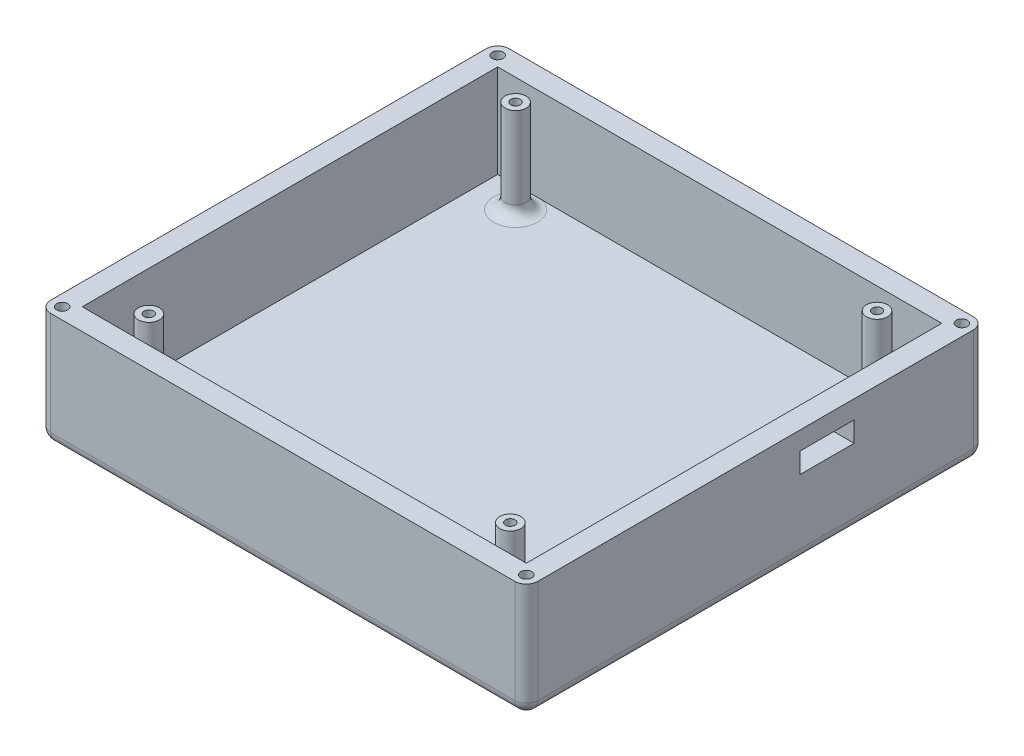
from build123d import *

# Parameters (mm, degrees)
SKETCH1_W            = 107.95
SKETCH1_H            = 25.4
BOSS_EXTRUDE1_DEPTH  = 50.8
SKETCH2_W            = 98.425
SKETCH2_H            = 92.075
CUT_EXTRUDE1_DEPTH   = 20.6375
FILLET1_R            = 2.54
FILLET2_R            = 2.54
SKETCH8_R            = 1.2192
CUT_EXTRUDE2_DEPTH   = 5.08
SKETCH9_R            = 2.322503919
SKETCH9_R_2          = 1.052503919
BOSS_EXTRUDE2_DEPTH  = 20.6375
LPATTERN1_COUNT      = 2
LPATTERN1_PITCH      = 80.1116
LPATTERN1_COUNT_DIR2 = 2
LPATTERN1_PITCH_DIR2 = 81.28
SKETCH10_W           = 12
SKETCH10_H           = 4.499991
CUT_EXTRUDE3_DEPTH   = 4.7625
FILLET3_R            = 2.54


with BuildPart() as part:
    # Sketch1 → Boss-Extrude1 (new, symmetric)
    with BuildSketch(Plane.XY):
        with Locations((0, 12.7)):
            Rectangle(SKETCH1_W, SKETCH1_H)
    extrude(amount=BOSS_EXTRUDE1_DEPTH, both=True)

    # Sketch2 → Cut-Extrude1 (cut)
    with BuildSketch(Plane(origin=(0, 25.4, 0), x_dir=(1, 0, 0), z_dir=(0, 1, 0))):
        Rectangle(SKETCH2_W, SKETCH2_H)
    extrude(amount=-CUT_EXTRUDE1_DEPTH, mode=Mode.SUBTRACT)

    # Fillet1
    fillet1_edges = [part.edges().sort_by_distance(p)[0] for p in [
        (53.975, 12.7, 50.8),
        (-53.975, 12.7, 50.8),
        (53.975, 12.7, -50.8),
        (-53.975, 12.7, -50.8),
    ]]
    fillet(fillet1_edges, radius=FILLET1_R)

    # Fillet2
    fillet2_edges = [part.edges().sort_by_distance(p)[0] for p in [
        (53.975, 0, 0),
        (0, 0, -50.8),
        (0, 0, 50.8),
        (-53.975, 0, 0),
        (53.231051224, 0, 50.056051224),
        (-53.231051224, 0, 50.056051224),
        (-53.231051224, 0, -50.056051224),
        (53.231051224, 0, -50.056051224),
    ]]
    fillet(fillet2_edges, radius=FILLET2_R)

    # Sketch8 → Cut-Extrude2 (cut)
    with BuildSketch(Plane(origin=(0, 25.4, 0), x_dir=(1, 0, 0), z_dir=(0, 1, 0))):
        with Locations(Location((-51.435, -48.26, 0), (0, 0, 180))):
            Circle(SKETCH8_R)
        with Locations(Location((51.435, -48.26, 0), (0, 0, 180))):
            Circle(SKETCH8_R)
        with Locations(Location((-51.435, 48.26, 0), (0, 0, 180))):
            Circle(SKETCH8_R)
        with Locations(Location((51.435, 48.26, 0), (0, 0, 180))):
            Circle(SKETCH8_R)
    extrude(amount=-CUT_EXTRUDE2_DEPTH, mode=Mode.SUBTRACT)

    # Sketch9 → Boss-Extrude2 (add)
    with BuildSketch(Plane(origin=(0, 4.7625, 0), x_dir=(1, 0, 0), z_dir=(0, 1, 0))):
        with Locations(Location((-40.479234444, 41.271455009, 0), (0, 0, 90))):
            Circle(SKETCH9_R)
        with Locations(Location((-40.479234444, 41.271455009, 0), (0, 0, 90))):
            Circle(SKETCH9_R_2, mode=Mode.SUBTRACT)
    boss_extrude2 = extrude(amount=BOSS_EXTRUDE2_DEPTH)

    # LPattern1: Boss-Extrude2 2 × 2
    with Locations(*[(i * LPATTERN1_PITCH, 0, j * LPATTERN1_PITCH_DIR2) for i in range(LPATTERN1_COUNT) for j in range(LPATTERN1_COUNT_DIR2) if (i, j) != (0, 0)]):
        add(boss_extrude2)

    # Sketch10 → Cut-Extrude3 (cut)
    with BuildSketch(Plane(origin=(53.975, 0, 0), x_dir=(0, 0, -1), z_dir=(1, 0, 0))):
        with Locations((15.849485077, 19.101581537)):
            Rectangle(SKETCH10_W, SKETCH10_H)
    extrude(amount=-CUT_EXTRUDE3_DEPTH, mode=Mode.SUBTRACT)

    # Fillet3
    # the kernel refuses this fillet: 2.54 mm, written as the material it adds along each edge
    with BuildSketch(Plane(origin=(-40.479234444, 4.7625, -41.271455009), x_dir=(0, 0, -1), z_dir=(1, 0, 0))) as fillet3_piece_1:
        with BuildLine():
            CenterArc((2.322503919 + FILLET3_R, FILLET3_R), FILLET3_R, 180, 90)
            Line((2.322503919, FILLET3_R), (2.322503919, 0))
            Line((2.322503919, 0), (2.322503919 + FILLET3_R, 0))
        make_face()
    revolve(axis=Axis((-40.479234444, 4.7625, -41.271455009), (0, 1, 0)))
    with BuildSketch(Plane(origin=(-40.479234444, 4.7625, 40.008544991), x_dir=(0, 0, -1), z_dir=(1, 0, 0))) as fillet3_piece_2:
        with BuildLine():
            CenterArc((2.322503919 + FILLET3_R, FILLET3_R), FILLET3_R, 180, 90)
            Line((2.322503919, FILLET3_R), (2.322503919, 0))
            Line((2.322503919, 0), (2.322503919 + FILLET3_R, 0))
        make_face()
    revolve(axis=Axis((-40.479234444, 4.7625, 40.008544991), (0, 1, 0)))
    with BuildSketch(Plane(origin=(39.632365556, 4.7625, -41.271455009), x_dir=(0, 0, -1), z_dir=(1, 0, 0))) as fillet3_piece_3:
        with BuildLine():
            CenterArc((2.322503919 + FILLET3_R, FILLET3_R), FILLET3_R, 180, 90)
            Line((2.322503919, FILLET3_R), (2.322503919, 0))
            Line((2.322503919, 0), (2.322503919 + FILLET3_R, 0))
        make_face()
    revolve(axis=Axis((39.632365556, 4.7625, -41.271455009), (0, 1, 0)))
    with BuildSketch(Plane(origin=(39.632365556, 4.7625, 40.008544991), x_dir=(0, 0, -1), z_dir=(1, 0, 0))) as fillet3_piece_4:
        with BuildLine():
            CenterArc((2.322503919 + FILLET3_R, FILLET3_R), FILLET3_R, 180, 90)
            Line((2.322503919, FILLET3_R), (2.322503919, 0))
            Line((2.322503919, 0), (2.322503919 + FILLET3_R, 0))
        make_face()
    revolve(axis=Axis((39.632365556, 4.7625, 40.008544991), (0, 1, 0)))


solid = part.part
